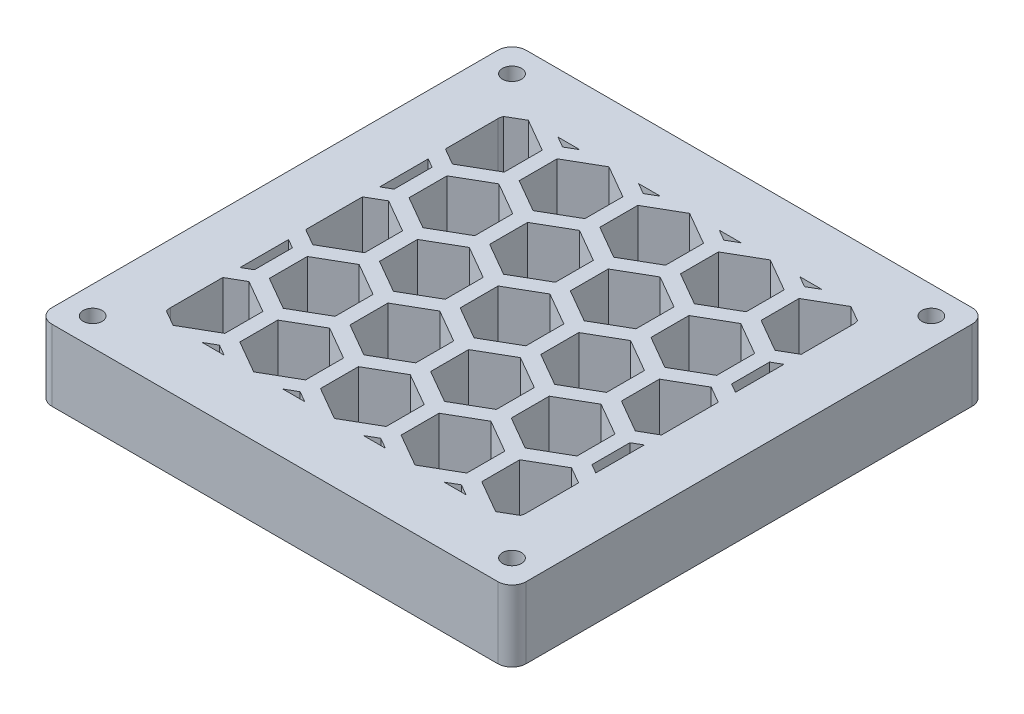
from build123d import *

# Parameters (mm, degrees)
SKETCH2_R           = 1
BOSS_EXTRUDE1_DEPTH = 7.5
BOSS_EXTRUDE2_DEPTH = 7.5
FILL_PATTERN9_DEPTH = 7.5


# Read off the part's stored shape, not the designer's step: Fill Pattern9
with BuildPart() as part:
    # Sketch2 → Boss-Extrude1 (new body)
    with BuildSketch(Plane(origin=(0, 0, 0), x_dir=(1, 0, 0), z_dir=(0, 1, 0))):
        with BuildLine():
            ThreePointArc((-25, 23.5), (-24.560660172, 24.560660172), (-23.5, 25))
            Line((-23.5, 25), (23.5, 25))
            ThreePointArc((23.5, 25), (24.560660172, 24.560660172), (25, 23.5))
            Line((25, 23.5), (25, -23.5))
            ThreePointArc((25, -23.5), (24.560660172, -24.560660172), (23.5, -25))
            Line((23.5, -25), (-23.5, -25))
            ThreePointArc((-23.5, -25), (-24.560660172, -24.560660172), (-25, -23.5))
            Line((-25, -23.5), (-25, 23.5))
        make_face()
        with Locations(Location((-22.1, -22.1, 0), (0, 0, 270))):
            Circle(SKETCH2_R, mode=Mode.SUBTRACT)
        with Locations(Location((-22.1, 22.1, 0), (0, 0, 270))):
            Circle(SKETCH2_R, mode=Mode.SUBTRACT)
        with Locations(Location((22.1, -22.1, 0), (0, 0, 270))):
            Circle(SKETCH2_R, mode=Mode.SUBTRACT)
        with Locations(Location((22.1, 22.1, 0), (0, 0, 270))):
            Circle(SKETCH2_R, mode=Mode.SUBTRACT)
        with BuildLine():
            Line((-18.75, -17.25), (-18.75, 17.25))
            ThreePointArc((-18.75, 17.25), (-18.310660172, 18.310660172), (-17.25, 18.75))
            Line((-17.25, 18.75), (17.25, 18.75))
            ThreePointArc((17.25, 18.75), (18.310660172, 18.310660172), (18.75, 17.25))
            Line((18.75, 17.25), (18.75, -17.25))
            ThreePointArc((18.75, -17.25), (18.310660172, -18.310660172), (17.25, -18.75))
            Line((17.25, -18.75), (-17.25, -18.75))
            ThreePointArc((-17.25, -18.75), (-18.310660172, -18.310660172), (-18.75, -17.25))
        make_face(mode=Mode.SUBTRACT)
    extrude(amount=BOSS_EXTRUDE1_DEPTH)


with BuildPart() as body_2:
    # Sketch2<3> → Boss-Extrude2 (new body)
    with BuildSketch(Plane(origin=(0, 0, 0), x_dir=(1, 0, 0), z_dir=(0, 1, 0))):
        with BuildLine():
            ThreePointArc((-18.75, 17.25), (-18.310660172, 18.310660172), (-17.25, 18.75))
            Line((-17.25, 18.75), (17.25, 18.75))
            ThreePointArc((17.25, 18.75), (18.310660172, 18.310660172), (18.75, 17.25))
            Line((18.75, 17.25), (18.75, -17.25))
            ThreePointArc((18.75, -17.25), (18.310660172, -18.310660172), (17.25, -18.75))
            Line((17.25, -18.75), (-17.25, -18.75))
            ThreePointArc((-17.25, -18.75), (-18.310660172, -18.310660172), (-18.75, -17.25))
            Line((-18.75, -17.25), (-18.75, 17.25))
        make_face()
    extrude(amount=BOSS_EXTRUDE2_DEPTH)

    # Fill Pattern9 outline → Fill Pattern9 (cut)
    with BuildSketch(Plane(origin=(0, 0, 0), x_dir=(1, 0, 0), z_dir=(0, 1, 0))):
        Polygon((-13.904155872, 18.75), (-12.75, 18.083647797), (-11.595844128, 18.75), align=None)
        Polygon((-3.095844128, 18.75), (-5.404155872, 18.75), (-4.25, 18.083647797), align=None)
        with BuildLine():
            Line((-17, 18.722431864), (-18.658954062, 17.76463429))
            ThreePointArc((-18.658954062, 17.76463429), (-18.727063149, 17.511312942), (-18.75, 17.25))
            Line((-18.75, 17.25), (-18.75, 11.732794835))
            Line((-18.75, 11.732794835), (-17, 10.722431864))
            Line((-17, 10.722431864), (-13.535898385, 12.722431864))
            Line((-13.535898385, 12.722431864), (-13.535898385, 16.722431864))
            Line((-13.535898385, 16.722431864), (-17, 18.722431864))
        make_face()
        Polygon((5.404155872, 18.75), (3.095844128, 18.75), (4.25, 18.083647797), align=None)
        Polygon((-17.785898385, 9.361215932), (-18.75, 9.917840259), (-18.75, 4.804591605), (-17.785898385, 5.361215932), align=None)
        Polygon((13.904155872, 18.75), (11.595844128, 18.75), (12.75, 18.083647797), align=None)
        Polygon((-17, 4), (-18.75, 2.989637029), (-18.75, -2.989637029), (-17, -4), (-13.535898385, -2), (-13.535898385, 2), align=None)
        with BuildLine():
            ThreePointArc((18.75, 17.25), (18.727063149, 17.511312942), (18.658954062, 17.76463429))
            Line((18.658954062, 17.76463429), (17, 18.722431864))
            Line((17, 18.722431864), (13.535898385, 16.722431864))
            Line((13.535898385, 16.722431864), (13.535898385, 12.722431864))
            Line((13.535898385, 12.722431864), (17, 10.722431864))
            Line((17, 10.722431864), (18.75, 11.732794835))
            Line((18.75, 11.732794835), (18.75, 17.25))
        make_face()
        Polygon((-17.785898385, -5.361215932), (-18.75, -4.804591605), (-18.75, -9.917840259), (-17.785898385, -9.361215932), align=None)
        with BuildLine():
            Line((-17, -10.722431864), (-18.75, -11.732794835))
            Line((-18.75, -11.732794835), (-18.75, -17.25))
            ThreePointArc((-18.75, -17.25), (-18.727063149, -17.511312942), (-18.658954062, -17.76463429))
            Line((-18.658954062, -17.76463429), (-17, -18.722431864))
            Line((-17, -18.722431864), (-13.535898385, -16.722431864))
            Line((-13.535898385, -16.722431864), (-13.535898385, -12.722431864))
            Line((-13.535898385, -12.722431864), (-17, -10.722431864))
        make_face()
        Polygon((18.75, 4.804591605), (18.75, 9.917840259), (17.785898385, 9.361215932), (17.785898385, 5.361215932), align=None)
        Polygon((18.75, -2.989637029), (18.75, 2.989637029), (17, 4), (13.535898385, 2), (13.535898385, -2), (17, -4), align=None)
        Polygon((-12.75, -18.083647797), (-13.904155872, -18.75), (-11.595844128, -18.75), align=None)
        Polygon((18.75, -9.917840259), (18.75, -4.804591605), (17.785898385, -5.361215932), (17.785898385, -9.361215932), align=None)
        Polygon((-4.25, -18.083647797), (-5.404155872, -18.75), (-3.095844128, -18.75), align=None)
        with BuildLine():
            Line((18.75, -17.25), (18.75, -11.732794835))
            Line((18.75, -11.732794835), (17, -10.722431864))
            Line((17, -10.722431864), (13.535898385, -12.722431864))
            Line((13.535898385, -12.722431864), (13.535898385, -16.722431864))
            Line((13.535898385, -16.722431864), (17, -18.722431864))
            Line((17, -18.722431864), (18.658954062, -17.76463429))
            ThreePointArc((18.658954062, -17.76463429), (18.727063149, -17.511312942), (18.75, -17.25))
        make_face()
        Polygon((4.25, -18.083647797), (3.095844128, -18.75), (5.404155872, -18.75), align=None)
        Polygon((12.75, -18.083647797), (11.595844128, -18.75), (13.904155872, -18.75), align=None)
        Polygon((-3.464101615, 12.722431864), (0, 10.722431864), (3.464101615, 12.722431864), (3.464101615, 16.722431864), (0, 18.722431864), (-3.464101615, 16.722431864), align=None)
        Polygon((9.285898385, 5.361215932), (12.75, 3.361215932), (16.214101615, 5.361215932), (16.214101615, 9.361215932), (12.75, 11.361215932), (9.285898385, 9.361215932), align=None)
        Polygon((5.035898385, 12.722431864), (8.5, 10.722431864), (11.964101615, 12.722431864), (11.964101615, 16.722431864), (8.5, 18.722431864), (5.035898385, 16.722431864), align=None)
        Polygon((-5.035898385, -12.722431864), (-8.5, -10.722431864), (-11.964101615, -12.722431864), (-11.964101615, -16.722431864), (-8.5, -18.722431864), (-5.035898385, -16.722431864), align=None)
        Polygon((8.5, -10.722431864), (5.035898385, -12.722431864), (5.035898385, -16.722431864), (8.5, -18.722431864), (11.964101615, -16.722431864), (11.964101615, -12.722431864), align=None)
        Polygon((0, -10.722431864), (-3.464101615, -12.722431864), (-3.464101615, -16.722431864), (0, -18.722431864), (3.464101615, -16.722431864), (3.464101615, -12.722431864), align=None)
        Polygon((12.75, -3.361215932), (9.285898385, -5.361215932), (9.285898385, -9.361215932), (12.75, -11.361215932), (16.214101615, -9.361215932), (16.214101615, -5.361215932), align=None)
        Polygon((-9.285898385, -5.361215932), (-12.75, -3.361215932), (-16.214101615, -5.361215932), (-16.214101615, -9.361215932), (-12.75, -11.361215932), (-9.285898385, -9.361215932), align=None)
        Polygon((-3.464101615, 2), (-3.464101615, -2), (0, -4), (3.464101615, -2), (3.464101615, 2), (0, 4), align=None)
        Polygon((4.25, -3.361215932), (0.785898385, -5.361215932), (0.785898385, -9.361215932), (4.25, -11.361215932), (7.714101615, -9.361215932), (7.714101615, -5.361215932), align=None)
        Polygon((-11.964101615, 16.722431864), (-11.964101615, 12.722431864), (-8.5, 10.722431864), (-5.035898385, 12.722431864), (-5.035898385, 16.722431864), (-8.5, 18.722431864), align=None)
        Polygon((-11.964101615, 2), (-11.964101615, -2), (-8.5, -4), (-5.035898385, -2), (-5.035898385, 2), (-8.5, 4), align=None)
        Polygon((-4.25, -3.361215932), (-7.714101615, -5.361215932), (-7.714101615, -9.361215932), (-4.25, -11.361215932), (-0.785898385, -9.361215932), (-0.785898385, -5.361215932), align=None)
        Polygon((8.5, 4), (5.035898385, 2), (5.035898385, -2), (8.5, -4), (11.964101615, -2), (11.964101615, 2), align=None)
        Polygon((-7.714101615, 5.361215932), (-4.25, 3.361215932), (-0.785898385, 5.361215932), (-0.785898385, 9.361215932), (-4.25, 11.361215932), (-7.714101615, 9.361215932), align=None)
        Polygon((-12.75, 11.361215932), (-16.214101615, 9.361215932), (-16.214101615, 5.361215932), (-12.75, 3.361215932), (-9.285898385, 5.361215932), (-9.285898385, 9.361215932), align=None)
        Polygon((4.25, 11.361215932), (0.785898385, 9.361215932), (0.785898385, 5.361215932), (4.25, 3.361215932), (7.714101615, 5.361215932), (7.714101615, 9.361215932), align=None)
    extrude(amount=FILL_PATTERN9_DEPTH, mode=Mode.SUBTRACT)


with BuildPart() as part_1:
    add(part.part)

    # Combine1: union body 2
    add(body_2.part)


solid = part_1.part
